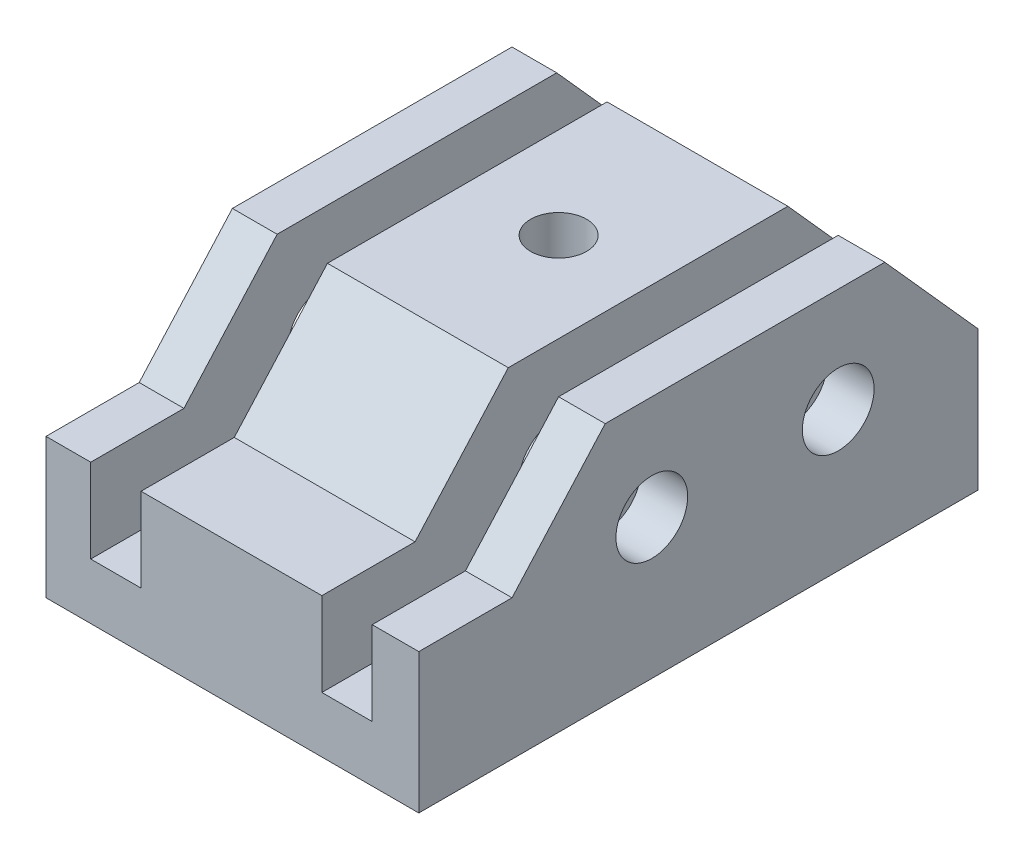
from build123d import *

# Parameters (mm, degrees)
SKETCH1_W           = 63.5
SKETCH1_H           = 6.35
BOSS_EXTRUDE1_DEPTH = 50.8
BOSS_EXTRUDE2_DEPTH = 50.8
SKETCH10_W          = 6.858
SKETCH10_H          = 25.629031657
CUT_EXTRUDE1_DEPTH  = 88.854357354
LPATTERN3_COUNT     = 2
LPATTERN3_PITCH     = 31.496
SKETCH11_R          = 4.8895
CUT_EXTRUDE2_DEPTH  = 88.854357354
BOSS_EXTRUDE3_DEPTH = 12.7
SKETCH23_R          = 3.81
CUT_EXTRUDE6_DEPTH  = 88.854357354
SKETCH24_W          = 22.86
SKETCH24_H          = 58.42
CUT_EXTRUDE7_DEPTH  = 4.58
SKETCH25_R          = 7
CUT_EXTRUDE8_DEPTH  = 2.799999956
SKETCH26_R          = 3
CUT_EXTRUDE9_DEPTH  = 10


with BuildPart() as part:
    # Sketch1 → Boss-Extrude1 (new body)
    with BuildSketch(Plane(origin=(0, 0, 0), x_dir=(0, 0, -1), z_dir=(1, 0, 0))):
        with Locations((31.75, 3.175)):
            Rectangle(SKETCH1_W, SKETCH1_H)
    extrude(amount=-BOSS_EXTRUDE1_DEPTH)

    # Sketch2 → Boss-Extrude2 (add)
    with BuildSketch(Plane(origin=(0, 0, 0), x_dir=(0, 0, -1), z_dir=(1, 0, 0))):
        Polygon((0, 6.35), (0, 19.05), (12.7, 33.249031657), (50.8, 33.249031657), (63.5, 19.05), (63.5, 6.35), align=None)
    extrude(amount=-BOSS_EXTRUDE2_DEPTH)

    # Sketch10 → Cut-Extrude1 (cut, through all)
    with BuildSketch(Plane(origin=(0, 0, -63.5), x_dir=(-1, 0, 0), z_dir=(0, 0, -1))):
        with Locations((9.779, 20.434515829)):
            Rectangle(SKETCH10_W, SKETCH10_H)
    cut_extrude1 = extrude(amount=-CUT_EXTRUDE1_DEPTH, mode=Mode.SUBTRACT)

    # LPattern3: Cut-Extrude1 ×2
    with Locations(*[(-i * LPATTERN3_PITCH, 0, 0) for i in range(1, LPATTERN3_COUNT)]):
        add(cut_extrude1, mode=Mode.SUBTRACT)

    # Sketch11 → Cut-Extrude2 (cut, through all)
    with BuildSketch(Plane(origin=(0, 0, 0), x_dir=(0, 0, -1), z_dir=(1, 0, 0))):
        with Locations((19.05, 19.05)):
            Circle(SKETCH11_R)
        with Locations((44.45, 19.05)):
            Circle(SKETCH11_R)
    extrude(amount=-CUT_EXTRUDE2_DEPTH, mode=Mode.SUBTRACT)

    # Sketch22 → Boss-Extrude3 (add)
    with BuildSketch(Plane.XY):
        Polygon((0, 0), (-50.8, 0), (-50.8, 7.62), (-50.8, 19.05), (-44.704, 19.05), (-44.704, 7.62), (-37.846, 7.62), (-37.846, 19.05), (-13.208, 19.05), (-13.208, 7.62), (-6.35, 7.62), (-6.35, 19.05), (0, 19.05), (0, 7.62), align=None)
    extrude(amount=BOSS_EXTRUDE3_DEPTH)

    # Sketch23 → Cut-Extrude6 (cut, through all)
    with BuildSketch(Plane(origin=(0, 33.249031657, 0), x_dir=(1, 0, 0), z_dir=(0, 1, 0))):
        with Locations((-25.4, 31.75)):
            Circle(SKETCH23_R)
    extrude(amount=-CUT_EXTRUDE6_DEPTH, mode=Mode.SUBTRACT)

    # Sketch24 → Cut-Extrude7 (cut)
    with BuildSketch(Plane.XZ):
        with Locations((-25.4, -21.59)):
            Rectangle(SKETCH24_W, SKETCH24_H)
    extrude(amount=-CUT_EXTRUDE7_DEPTH, mode=Mode.SUBTRACT)

    # Sketch25 → Cut-Extrude8 (cut)
    with BuildSketch(Plane.XZ.offset(-4.58)):
        with Locations((-25.4, -31.75)):
            Circle(SKETCH25_R)
    extrude(amount=-CUT_EXTRUDE8_DEPTH, mode=Mode.SUBTRACT)

    # Sketch26 → Cut-Extrude9 (cut)
    with BuildSketch(Plane(origin=(0, 4.58, 0), x_dir=(-1, 0, 0), z_dir=(0, -1, 0))):
        with Locations((30.4, 46.15)):
            Circle(SKETCH26_R)
        with Locations((20.4, 46.15)):
            Circle(SKETCH26_R)
        with Locations((20.4, -1.89703266)):
            Circle(SKETCH26_R)
        with Locations((30.4, -1.89703266)):
            Circle(SKETCH26_R)
    extrude(amount=-CUT_EXTRUDE9_DEPTH, mode=Mode.SUBTRACT)


solid = part.part
